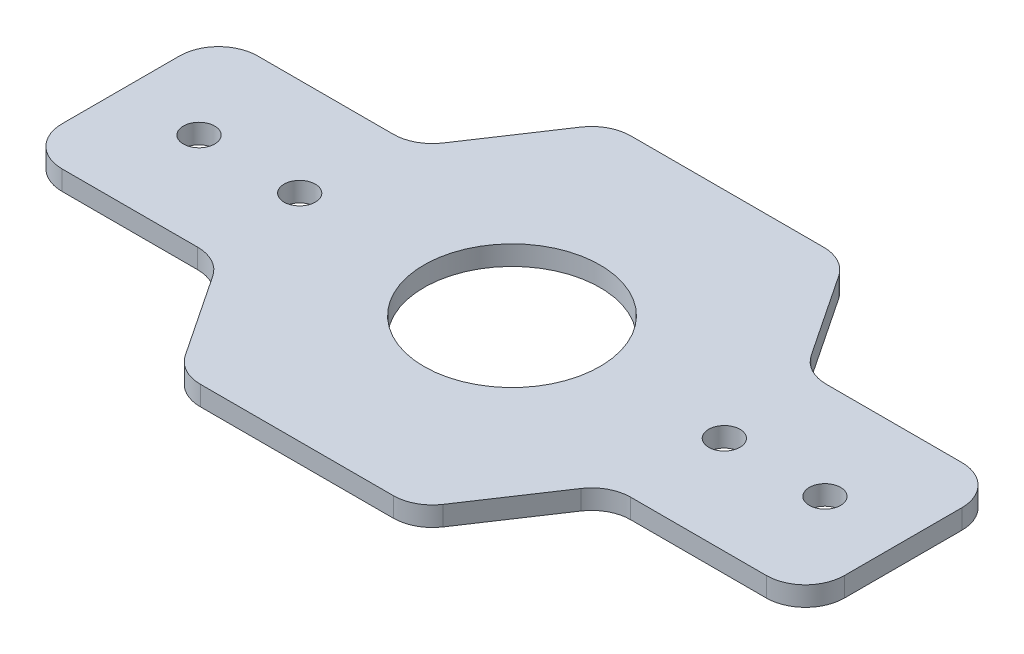
from build123d import *

# Parameters (mm, degrees)
SKETCH1_R           = 2.54
BOSS_EXTRUDE1_DEPTH = 3.175
FILLET1_R           = 6.35
SKETCH2_R           = 14.2875
CUT_EXTRUDE1_DEPTH  = 3.175
SKETCH3_R           = 2.54
CUT_EXTRUDE2_DEPTH  = 120.558881937


with BuildPart() as part:
    # Sketch1 → Boss-Extrude1 (new body)
    with BuildSketch(Plane(origin=(0, 0, 0), x_dir=(1, 0, 0), z_dir=(0, 1, 0))):
        Polygon((19.05, 15.875), (31.75, 34.925), (69.85, 34.925), (82.55, 15.875), (114.3, 15.875), (114.3, -15.875), (82.55, -15.875), (69.85, -34.925), (31.75, -34.925), (19.05, -15.875), (-12.7, -15.875), (-12.7, 15.875), align=None)
        Circle(SKETCH1_R, mode=Mode.SUBTRACT)
        with Locations((101.6, 0)):
            Circle(SKETCH1_R, mode=Mode.SUBTRACT)
    extrude(amount=BOSS_EXTRUDE1_DEPTH)

    # Fillet1
    fillet1_edges = [part.edges().sort_by_distance(p)[0] for p in [
        (19.05, 1.5875, -15.875),
        (31.75, 1.5875, -34.925),
        (69.85, 1.5875, -34.925),
        (82.55, 1.5875, -15.875),
        (114.3, 1.5875, -15.875),
        (114.3, 1.5875, 15.875),
        (82.55, 1.5875, 15.875),
        (69.85, 1.5875, 34.925),
        (31.75, 1.5875, 34.925),
        (19.05, 1.5875, 15.875),
        (-12.7, 1.5875, -15.875),
        (-12.7, 1.5875, 15.875),
    ]]
    fillet(fillet1_edges, radius=FILLET1_R)

    # Sketch2 → Cut-Extrude1 (cut)
    with BuildSketch(Plane(origin=(0, 3.175, 0), x_dir=(1, 0, 0), z_dir=(0, 1, 0))):
        with Locations((50.8, 0)):
            Circle(SKETCH2_R)
    extrude(amount=-CUT_EXTRUDE1_DEPTH, mode=Mode.SUBTRACT)

    # Sketch3 → Cut-Extrude2 (cut, through all)
    with BuildSketch(Plane(origin=(0, 3.175, 0), x_dir=(1, 0, 0), z_dir=(0, 1, 0))):
        with Locations((85.2619199, 0)):
            Circle(SKETCH3_R)
        with Locations((16.3380801, 0)):
            Circle(SKETCH3_R)
    extrude(amount=-CUT_EXTRUDE2_DEPTH, mode=Mode.SUBTRACT)


solid = part.part
